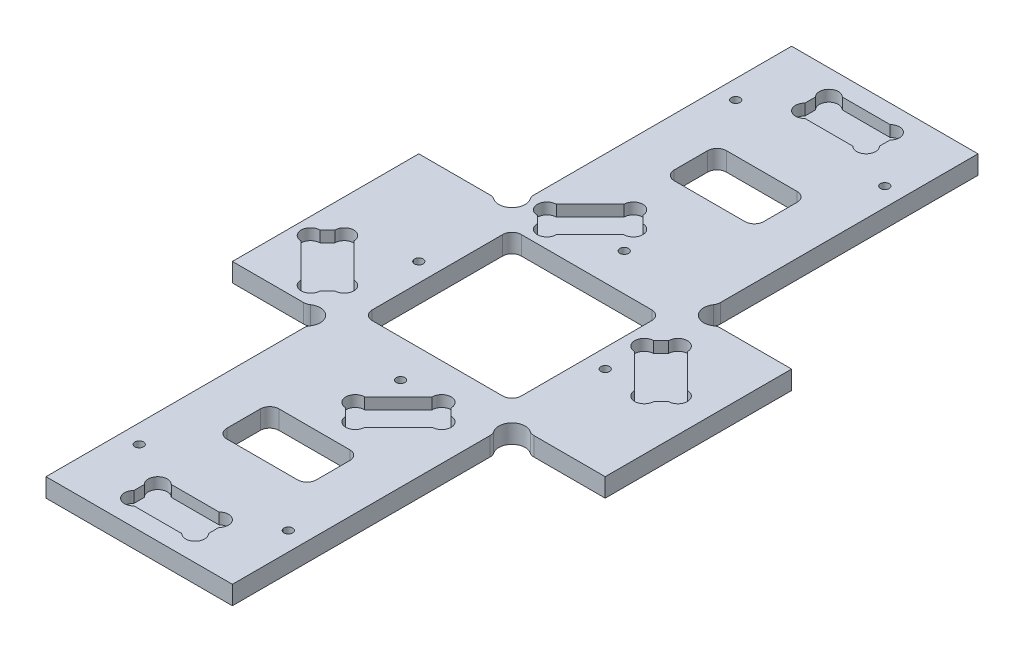
from build123d import *

# Parameters (mm, degrees)
BOSS_EXTRUDE1_DEPTH      = 6.35
CUT_EXTRUDE14_DEPTH      = 3.81
SKETCH14_W               = 25.4
SKETCH14_H               = 12.7
CUT_EXTRUDE16_DEPTH      = 3.81
SKETCH15_W               = 30.48
SKETCH15_H               = 17.78
SKETCH15_W_2             = 50.8
SKETCH15_H_2             = 50.8
CUT_EXTRUDE17_DEPTH      = 271.379606021
FILLET1_R                = 3.175
SKETCH16_R               = 4.490128061
CUT_EXTRUDE18_DEPTH      = 271.379606021
FILLET2_R                = 3.175
SKETCH17_R               = 3.232892204
CUT_EXTRUDE19_DEPTH      = 3.81
SKETCH18_R               = 3.232892204
CUT_EXTRUDE20_DEPTH      = 3.81
SKETCH19_R               = 3.232892204
CUT_EXTRUDE22_DEPTH      = 3.81
CUT_EXTRUDE23_DEPTH      = 271.379606021
CUT_EXTRUDE23_DEPTH_BACK = 271.379606021
SKETCH20_R               = 1.4732
SKETCH21_R               = 1.4732
CUT_EXTRUDE24_DEPTH      = 271.379606021


with BuildPart() as part:
    # Sketch1 → Boss-Extrude1 (new body)
    with BuildSketch(Plane(origin=(0, 0, 0), x_dir=(1, 0, 0), z_dir=(0, 1, 0))):
        Polygon((77.155685619, 247.395150502), (13.655685619, 247.395150502), (13.655685619, 152.145150502), (-18.094314381, 152.145150502), (-18.094314381, 88.645150502), (13.655685619, 88.645150502), (13.655685619, -6.604849498), (77.155685619, -6.604849498), (77.155685619, 88.645150502), (108.905685619, 88.645150502), (108.905685619, 152.145150502), (77.155685619, 152.145150502), align=None)
    extrude(amount=BOSS_EXTRUDE1_DEPTH)

    # Sketch2 → Cut-Extrude14 (cut)
    with BuildSketch(Plane(origin=(0, 6.35, 0), x_dir=(1, 0, 0), z_dir=(0, 1, 0))):
        Polygon((2.300456238, 91.658330914), (11.280712359, 100.638587035), (-6.679799883, 118.599099277), (-15.660056005, 109.618843156), align=None)
        Polygon((25.962587035, 148.485287641), (43.923099277, 166.445799883), (34.942843156, 175.426056005), (16.982330914, 157.465543762), align=None)
        Polygon((73.809287641, 133.803412965), (91.769799883, 115.842900723), (100.750056005, 124.823156844), (82.789543762, 142.783669086), align=None)
        Polygon((59.127412965, 85.956712359), (41.166900723, 67.996200117), (50.147156844, 59.015943995), (68.107669086, 76.976456238), align=None)
    extrude(amount=-CUT_EXTRUDE14_DEPTH, mode=Mode.SUBTRACT)

    # Sketch14 → Cut-Extrude16 (cut)
    with BuildSketch(Plane(origin=(0, 6.35, 0), x_dir=(1, 0, 0), z_dir=(0, 1, 0))):
        with Locations((45.405685619, 234.695150502)):
            Rectangle(SKETCH14_W, SKETCH14_H)
        with Locations((45.405685619, 6.095150502)):
            Rectangle(SKETCH14_W, SKETCH14_H)
    extrude(amount=-CUT_EXTRUDE16_DEPTH, mode=Mode.SUBTRACT)

    # Sketch15 → Cut-Extrude17 (cut, through all)
    with BuildSketch(Plane(origin=(0, 6.35, 0), x_dir=(1, 0, 0), z_dir=(0, 1, 0))):
        with Locations((45.405685619, 44.195150502)):
            Rectangle(SKETCH15_W, SKETCH15_H)
        with Locations((45.405685619, 120.395150502)):
            Rectangle(SKETCH15_W_2, SKETCH15_H_2)
        with Locations((45.405685619, 196.595150502)):
            Rectangle(SKETCH15_W, SKETCH15_H)
    extrude(amount=-CUT_EXTRUDE17_DEPTH, mode=Mode.SUBTRACT)

    # Fillet1
    fillet1_edges = [part.edges().sort_by_distance(p)[0] for p in [
        (30.165685619, 3.175, -205.485150502),
        (30.165685619, 3.175, -187.705150502),
        (60.645685619, 3.175, -187.705150502),
        (60.645685619, 3.175, -205.485150502),
        (60.645685619, 3.175, -53.085150502),
        (30.165685619, 3.175, -53.085150502),
        (30.165685619, 3.175, -35.305150502),
        (60.645685619, 3.175, -35.305150502),
        (70.805685619, 3.175, -94.995150502),
        (70.805685619, 3.175, -145.795150502),
        (20.005685619, 3.175, -145.795150502),
        (20.005685619, 3.175, -94.995150502),
    ]]
    fillet(fillet1_edges, radius=FILLET1_R)

    # Sketch16 → Cut-Extrude18 (cut, through all)
    with BuildSketch(Plane(origin=(0, 6.35, 0), x_dir=(1, 0, 0), z_dir=(0, 1, 0))):
        with Locations((10.480685619, 85.470150502)):
            Circle(SKETCH16_R)
        with Locations((80.330685619, 85.470150502)):
            Circle(SKETCH16_R)
        with Locations((80.330685619, 155.320150502)):
            Circle(SKETCH16_R)
        with Locations((10.480685619, 155.320150502)):
            Circle(SKETCH16_R)
    extrude(amount=-CUT_EXTRUDE18_DEPTH, mode=Mode.SUBTRACT)

    # Fillet2
    fillet2_edges = [part.edges().sort_by_distance(p)[0] for p in [
        (13.655685619, 3.175, -158.495150502),
        (7.305685619, 3.175, -152.145150502),
        (77.155685619, 3.175, -158.495150502),
        (83.505685619, 3.175, -152.145150502),
        (77.155685619, 3.175, -82.295150502),
        (83.505685619, 3.175, -88.645150502),
        (13.655685619, 3.175, -82.295150502),
        (7.305685619, 3.175, -88.645150502),
    ]]
    fillet(fillet2_edges, radius=FILLET2_R)

    # Sketch17 → Cut-Extrude19 (cut)
    with BuildSketch(Plane(origin=(0, 6.35, 0), x_dir=(1, 0, 0), z_dir=(0, 1, 0))):
        with Locations((34.991685619, 10.159150502)):
            Circle(SKETCH17_R)
        with Locations((34.991685619, 2.031150502)):
            Circle(SKETCH17_R)
        with Locations((55.819685619, 2.031150502)):
            Circle(SKETCH17_R)
        with Locations((55.819685619, 10.159150502)):
            Circle(SKETCH17_R)
        with Locations((55.819685619, 238.759150502)):
            Circle(SKETCH17_R)
        with Locations((55.819685619, 230.631150502)):
            Circle(SKETCH17_R)
        with Locations((34.991685619, 230.631150502)):
            Circle(SKETCH17_R)
        with Locations((34.991685619, 238.759150502)):
            Circle(SKETCH17_R)
    extrude(amount=-CUT_EXTRUDE19_DEPTH, mode=Mode.SUBTRACT)

    # Sketch18 → Cut-Extrude20 (cut)
    with BuildSketch(Plane(origin=(0, 6.35, 0), x_dir=(1, 0, 0), z_dir=(0, 1, 0))):
        with Locations((-12.427163801, 109.618843156)):
            Circle(SKETCH18_R)
        with Locations((-6.679799883, 115.366207074)):
            Circle(SKETCH18_R)
        with Locations((8.047820155, 100.638587035)):
            Circle(SKETCH18_R)
        with Locations((2.300456238, 94.891223118)):
            Circle(SKETCH18_R)
    extrude(amount=-CUT_EXTRUDE20_DEPTH, mode=Mode.SUBTRACT)

    # Sketch19 → Cut-Extrude22 (cut)
    with BuildSketch(Plane(origin=(0, 6.35, 0), x_dir=(1, 0, 0), z_dir=(0, 1, 0))):
        with Locations((34.942843156, 172.193163801)):
            Circle(SKETCH19_R)
        with Locations((40.690207074, 166.445799883)):
            Circle(SKETCH19_R)
        with Locations((25.962587035, 151.718179845)):
            Circle(SKETCH19_R)
        with Locations((20.215223118, 157.465543762)):
            Circle(SKETCH19_R)
        with Locations((82.789543762, 139.550776882)):
            Circle(SKETCH19_R)
        with Locations((77.042179845, 133.803412965)):
            Circle(SKETCH19_R)
        with Locations((97.517163801, 124.823156844)):
            Circle(SKETCH19_R)
        with Locations((91.769799883, 119.075792926)):
            Circle(SKETCH19_R)
        with Locations((44.399792926, 67.996200117)):
            Circle(SKETCH19_R)
        with Locations((50.147156844, 62.248836199)):
            Circle(SKETCH19_R)
        with Locations((64.874776882, 76.976456238)):
            Circle(SKETCH19_R)
        with Locations((59.127412965, 82.723820155)):
            Circle(SKETCH19_R)
    extrude(amount=-CUT_EXTRUDE22_DEPTH, mode=Mode.SUBTRACT)

    # Sketch20 → Cut-Extrude23 (cut, two sides: drawn at the far end of the back side and taken through both)
    with BuildSketch(Plane(origin=(0, 6.35, 0), x_dir=(1, 0, 0), z_dir=(0, 1, 0)).offset(-CUT_EXTRUDE23_DEPTH_BACK)):
        with Locations((20.005685619, 221.995150502)):
            Circle(SKETCH20_R)
        with Locations((70.805685619, 221.995150502)):
            Circle(SKETCH20_R)
        with Locations((70.805685619, 18.795150502)):
            Circle(SKETCH20_R)
        with Locations((20.005685619, 18.795150502)):
            Circle(SKETCH20_R)
        with Locations((13.655685619, 120.395150502)):
            Circle(SKETCH20_R)
        with Locations((77.155685619, 120.395150502)):
            Circle(SKETCH20_R)
    extrude(amount=CUT_EXTRUDE23_DEPTH + CUT_EXTRUDE23_DEPTH_BACK, mode=Mode.SUBTRACT)

    # Sketch21 → Cut-Extrude24 (cut, through all)
    with BuildSketch(Plane(origin=(0, 6.35, 0), x_dir=(1, 0, 0), z_dir=(0, 1, 0))):
        with Locations((45.542086203, 158.495150502)):
            Circle(SKETCH21_R)
        with Locations((45.542086203, 82.295150502)):
            Circle(SKETCH21_R)
    extrude(amount=-CUT_EXTRUDE24_DEPTH, mode=Mode.SUBTRACT)


solid = part.part
